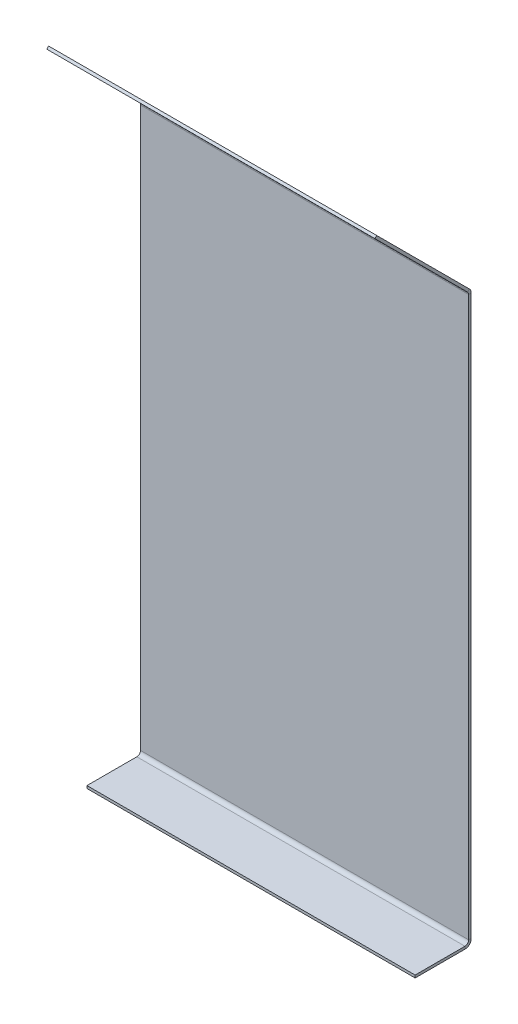
from build123d import *

# Parameters (mm, degrees)
SKETCH1_W          = 88.9
SKETCH1_H          = 12.7
BASE_FLANGE1_DEPTH = 0.7
EDGE_FLANGE1_DEPTH = 88.9
EDGE_FLANGE2_DEPTH = 88.9


# Sheet-metal steps are written as plain solids
with BuildPart() as part:
    # Sketch1 → Base-Flange1 (new body)
    with BuildSketch(Plane(origin=(0, 0, 0), x_dir=(1, 0, 0), z_dir=(0, 1, 0))):
        Rectangle(SKETCH1_W, SKETCH1_H)
    extrude(amount=-BASE_FLANGE1_DEPTH)

    # Edge-Flange1 section (across the edge) → Edge-Flange1 (add)
    with BuildSketch(Plane(origin=(44.45, 0, -8.15), x_dir=(0, 0, 1), z_dir=(-1, 0, 0))):
        with BuildLine():
            Line((-0.7, 1), (-0.7, 152.4))
            Line((-0.7, 152.4), (0, 152.4))
            Line((0, 152.4), (0, 1))
            ThreePointArc((0, 1), (0.292893219, 0.292893219), (1, 0))
            Line((1, 0), (1.8, 0))
            Line((1.8, 0), (1.8, -0.7))
            Line((1.8, -0.7), (1, -0.7))
            ThreePointArc((1, -0.7), (-0.202081528, -0.202081528), (-0.7, 1))
        make_face()
    extrude(amount=EDGE_FLANGE1_DEPTH)

    # Edge-Flange2 section (across the edge) → Edge-Flange2 (add)
    with BuildSketch(Plane(origin=(44.45, 152.814213562, -8.15), x_dir=(0, -0.7071067811865414, 0.7071067811865537), z_dir=(-1, 0, 0))):
        with BuildLine():
            Line((-0.7, 0.414213562), (-0.7, 35.9156))
            Line((-0.7, 35.9156), (0, 35.9156))
            Line((0, 35.9156), (0, 0.414213562))
            ThreePointArc((0, 0.414213562), (0.076120467, 0.03153013), (0.292893219, -0.292893219))
            Line((0.292893219, -0.292893219), (-0.202081528, -0.787867966))
            ThreePointArc((-0.202081528, -0.787867966), (-0.570595205, -0.236348273), (-0.7, 0.414213562))
        make_face()
    extrude(amount=EDGE_FLANGE2_DEPTH)


solid = part.part
